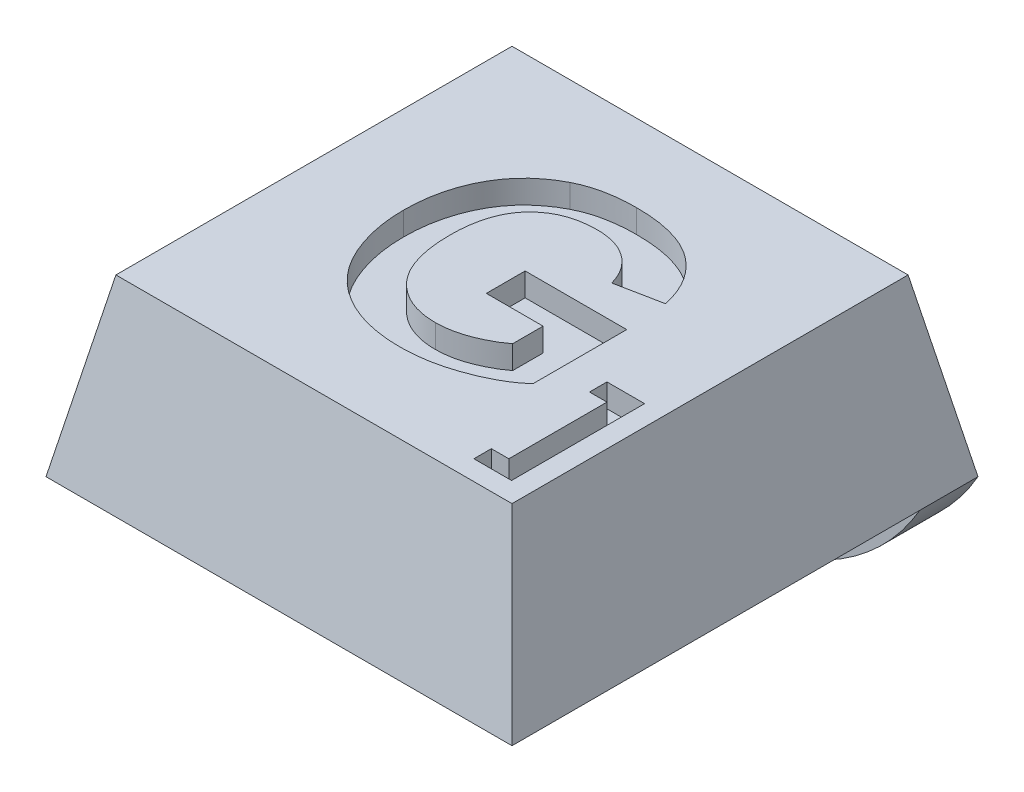
from build123d import *

# Parameters (mm, degrees)
SKETCH1_W               = 8
SKETCH1_H               = 8
BOSS_EXTRUDE1_DEPTH     = 3
CUT_EXTRUDE1_DEPTH      = 12.704699911
CUT_EXTRUDE1_DEPTH_BACK = 12.704699911
CUT_EXTRUDE2_DEPTH      = 11
SKETCH4_R               = 1.75
CUT_EXTRUDE3_DEPTH      = 0.4
SKETCH5_W               = 8
SKETCH5_H               = 1
BOSS_EXTRUDE2_DEPTH     = 2
FILLET1_R               = 4
CUT_EXTRUDE4_DEPTH      = 0.4
CUT_EXTRUDE5_DEPTH      = 0.4


with BuildPart() as part:
    # Sketch1 → Boss-Extrude1 (new body)
    with BuildSketch(Plane(origin=(0, 0, 0), x_dir=(1, 0, 0), z_dir=(0, 1, 0))):
        with Locations((4, 4)):
            Rectangle(SKETCH1_W, SKETCH1_H)
    extrude(amount=BOSS_EXTRUDE1_DEPTH)

    # Sketch2 → Cut-Extrude1 (cut, two sides: drawn at the far end of the back side and taken through both)
    with BuildSketch(Plane.XY.offset(-CUT_EXTRUDE1_DEPTH_BACK)):
        Polygon((0, 0), (0.6, 3), (0, 3), align=None)
        Polygon((8, 0), (7.4, 3), (8, 3), align=None)
    extrude(amount=CUT_EXTRUDE1_DEPTH + CUT_EXTRUDE1_DEPTH_BACK, mode=Mode.SUBTRACT)

    # Sketch3 → Cut-Extrude2 (cut)
    with BuildSketch(Plane(origin=(0, 0, 0), x_dir=(0, 0, -1), z_dir=(1, 0, 0))):
        Polygon((0, 0), (0.6, 3), (0, 3), align=None)
        Polygon((8, 3), (7.4, 3), (8, 0), align=None)
    extrude(amount=CUT_EXTRUDE2_DEPTH, mode=Mode.SUBTRACT)

    # Sketch4 → Cut-Extrude3 (cut)
    with BuildSketch(Plane.XZ):
        with Locations(Location((4, -3.75, 0), (0, 0, 270))):
            Circle(SKETCH4_R)
    extrude(amount=-CUT_EXTRUDE3_DEPTH, mode=Mode.SUBTRACT)

    # Sketch5 → Boss-Extrude2 (add)
    with BuildSketch(Plane.XZ):
        with Locations((4, -7.5)):
            Rectangle(SKETCH5_W, SKETCH5_H)
    extrude(amount=BOSS_EXTRUDE2_DEPTH)

    # Fillet1
    # the kernel refuses this fillet: 4 mm, written as the material it takes off along each edge
    with BuildSketch(Plane(origin=(8, -2, -16.660254038), x_dir=(0, 1, 0), z_dir=(0, 0, 1)), Plane(origin=(0, -2, 1.660254038), x_dir=(0, 1, 0), z_dir=(0, 0, -1))) as fillet1_piece_1:
        with BuildLine():
            CenterArc((4, 3.464101615), FILLET1_R, 180, 60)
            Line((0, 3.464101615), (-0.08, 3.464101615))
            Line((-0.08, 3.464101615), (-0.08, 0))
            Line((-0.08, 0), (0, -0.08))
            ThreePointArc((0, -0.08), (1, -0.08), (1.96, -0.069282032))
            Line((1.96, -0.069282032), (2, 0))
        make_face()
    extrude(amount=18.320508076, mode=Mode.SUBTRACT)

    # Sketch6 → Cut-Extrude4 (cut)
    with BuildSketch(Plane(origin=(0, 3, 0), x_dir=(1, 0, 0), z_dir=(0, 1, 0))):
        with BuildLine():
            Line((4.053794593, 3.505457585), (4.053794593, 4.172124252))
            Line((4.053794593, 4.172124252), (5.797384337, 4.172124252))
            Line((5.797384337, 4.172124252), (5.797384337, 2.564752457))
            add(Edge.make_bspline(
                [(5.797384337, 2.564752457), (5.775440275, 2.544992361), (5.730582172, 2.504598726), (5.657391115, 2.447633596), (5.576814656, 2.393249062), (5.489339896, 2.340343698), (5.394785806, 2.289343315), (5.293529517, 2.239537607), (5.185384208, 2.19141366), (5.032450931, 2.131128575), (4.835594452, 2.065533422), (4.594933471, 2.008496304), (4.352368706, 1.973513189), (4.190125473, 1.969167013), (4.109083055, 1.966996047)],
                knots=[0, 0, 0, 0, 0.581799769, 1.189316438, 1.825828404, 2.496525428, 3.203088405, 3.942228803, 4.719818701, 5.534979611, 7.181138583, 8.803804008, 10.403462225, 12, 12, 12, 12], degree=3))
            add(Edge.make_bspline(
                [(4.109083055, 1.966996047), (4.058312627, 1.967758979), (3.958229013, 1.969262944), (3.810482794, 1.981368296), (3.667847904, 2.002080495), (3.530208107, 2.031409962), (3.397097502, 2.066765974), (3.26907094, 2.111868039), (3.146582956, 2.166009466), (3.028523806, 2.226338905), (2.917094396, 2.295632176), (2.812187083, 2.371432832), (2.714561168, 2.454400196), (2.624566637, 2.544701507), (2.540998329, 2.641714843), (2.464831298, 2.745902822), (2.396526155, 2.857385727), (2.335239765, 2.974765127), (2.280716867, 3.097008702), (2.234709094, 3.223154334), (2.194374003, 3.351370526), (2.161222966, 3.482107416), (2.136875151, 3.615790052), (2.117947657, 3.751799892), (2.107781758, 3.890986734), (2.105984472, 3.984609884), (2.105076645, 4.031899893)],
                knots=[0, 0, 0, 0, 1.124918047, 2.217548049, 3.282233239, 4.316494221, 5.334437038, 6.332151046, 7.320712088, 8.300141923, 9.267552434, 10.225301062, 11.165776911, 12.103230934, 13.047553934, 14.000517593, 14.959782875, 15.941944936, 16.932894943, 17.923491392, 18.915624898, 19.910402922, 20.909870877, 21.92519501, 22.95199481, 24, 24, 24, 24], degree=3))
            add(Edge.make_bspline(
                [(2.105076645, 4.031899893), (2.105812881, 4.082940857), (2.107264322, 4.183564655), (2.119773705, 4.33228546), (2.139199297, 4.476648194), (2.168656936, 4.616390773), (2.20449512, 4.75216369), (2.248233589, 4.883877531), (2.301822866, 5.010556427), (2.361436063, 5.133283761), (2.429297714, 5.250362339), (2.505977563, 5.360290437), (2.589206445, 5.464176802), (2.680629029, 5.560371285), (2.779923369, 5.648827012), (2.886080088, 5.730522243), (2.998844963, 5.806865303), (3.079553832, 5.849911113), (3.120301004, 5.871643482)],
                knots=[0, 0, 0, 0, 1.105010302, 2.178452875, 3.229459892, 4.257086284, 5.268538906, 6.268935615, 7.259234261, 8.24469117, 9.221745683, 10.185929258, 11.144249683, 12.101504986, 13.055838221, 14.020611351, 15.000673771, 16, 16, 16, 16], degree=3))
            add(Edge.make_bspline(
                [(3.120301004, 5.871643482), (3.152638085, 5.887700047), (3.218317351, 5.920312247), (3.322813337, 5.959248923), (3.432101667, 5.994677516), (3.547832356, 6.021111591), (3.6692195, 6.042829226), (3.796209305, 6.059036287), (3.929210312, 6.067547239), (4.019595582, 6.068879104), (4.065813824, 6.069560149)],
                knots=[0, 0, 0, 0, 0.887969848, 1.803539625, 2.741143579, 3.713741423, 4.722068772, 5.775476617, 6.8624965, 8, 8, 8, 8], degree=3))
            add(Edge.make_bspline(
                [(4.065813824, 6.069560149), (4.125403824, 6.06867255), (4.241295356, 6.066946335), (4.410256532, 6.05256252), (4.569271079, 6.027772487), (4.718560435, 5.993629866), (4.857802985, 5.949731518), (4.986759025, 5.895763799), (5.106220057, 5.832812796), (5.214455834, 5.758355608), (5.313666102, 5.676257846), (5.403591975, 5.586419647), (5.48426965, 5.488707943), (5.555752499, 5.383614392), (5.617477906, 5.2707046), (5.670549966, 5.151008328), (5.714234697, 5.023616882), (5.73534656, 4.935145779), (5.746102286, 4.89007297)],
                knots=[0, 0, 0, 0, 1.271135529, 2.472123572, 3.614091059, 4.701890498, 5.736279567, 6.724681829, 7.680621489, 8.611506429, 9.52200816, 10.424540711, 11.318996785, 12.221421405, 13.131851814, 14.060431888, 15.011860567, 16, 16, 16, 16], degree=3))
            Line((5.746102286, 4.89007297), (4.976871517, 4.736226816))
            add(Edge.make_bspline(
                [(4.976871517, 4.736226816), (4.969254672, 4.761468809), (4.95422678, 4.81127079), (4.925094227, 4.882758251), (4.891539922, 4.949961192), (4.853483379, 5.013366036), (4.810541206, 5.072582433), (4.761675926, 5.126971617), (4.709961453, 5.179014495), (4.652020351, 5.225088646), (4.590259767, 5.266624284), (4.52537561, 5.304078684), (4.455901775, 5.334453158), (4.382811411, 5.358892727), (4.306461756, 5.37964837), (4.225856415, 5.392413169), (4.141900573, 5.402040295), (4.084540473, 5.402606041), (4.055397158, 5.402893482)],
                knots=[0, 0, 0, 0, 1.027736275, 2.027704492, 3.005900071, 3.954421694, 4.908588141, 5.853155543, 6.803277083, 7.766271258, 8.734041521, 9.704274878, 10.683578894, 11.68490234, 12.708089448, 13.76461009, 14.864251086, 16, 16, 16, 16], degree=3))
            add(Edge.make_bspline(
                [(4.055397158, 5.402893482), (4.01128773, 5.401716629), (3.925204424, 5.399419898), (3.799534269, 5.384433236), (3.680976007, 5.357770589), (3.569219615, 5.320994553), (3.46406021, 5.273789934), (3.366918824, 5.2143961), (3.275376693, 5.146327474), (3.192038786, 5.066438045), (3.116460773, 4.976859168), (3.051034483, 4.876522357), (2.996567377, 4.765751945), (2.951955713, 4.645104141), (2.91643531, 4.514573915), (2.892338718, 4.373699188), (2.876594443, 4.222696077), (2.875085403, 4.118480819), (2.874307414, 4.064752457)],
                knots=[0, 0, 0, 0, 1.043810997, 2.037086103, 2.989314757, 3.91471467, 4.817033861, 5.710208705, 6.603920097, 7.511448416, 8.435617211, 9.371747005, 10.338444094, 11.350425613, 12.411431869, 13.5347293, 14.729025275, 16, 16, 16, 16], degree=3))
            add(Edge.make_bspline(
                [(2.874307414, 4.064752457), (2.875118698, 4.00702506), (2.876695474, 3.894828493), (2.892027057, 3.732262921), (2.917247643, 3.580803592), (2.95342224, 3.44064155), (2.998941149, 3.311279521), (3.053656914, 3.192304252), (3.121182779, 3.085923464), (3.197244894, 2.990004781), (3.28225913, 2.906191636), (3.37384152, 2.833121051), (3.471482188, 2.77119638), (3.576081527, 2.721395085), (3.686320303, 2.681751972), (3.80321198, 2.653959398), (3.926408504, 2.636695674), (4.010734238, 2.634687946), (4.053794593, 2.633662713)],
                knots=[0, 0, 0, 0, 1.318042826, 2.561693173, 3.724929596, 4.821196409, 5.862977565, 6.853497791, 7.804600806, 8.73339865, 9.643480846, 10.524649628, 11.404635349, 12.277659519, 13.165160235, 14.075017549, 15.017020959, 16, 16, 16, 16], degree=3))
            add(Edge.make_bspline(
                [(4.053794593, 2.633662713), (4.097408334, 2.634875039), (4.185053042, 2.637311287), (4.316328539, 2.657956024), (4.448117665, 2.68833542), (4.577327471, 2.734163302), (4.70281192, 2.786727561), (4.819965055, 2.847306941), (4.929675356, 2.910453005), (4.995733738, 2.959668979), (5.028153568, 2.98382297)],
                knots=[0, 0, 0, 0, 0.993821502, 1.997150276, 3.023717651, 4.073291794, 5.118404464, 6.123376694, 7.078999408, 8, 8, 8, 8], degree=3))
            Line((5.028153568, 2.98382297), (5.028153568, 3.505457585))
            Line((5.028153568, 3.505457585), (4.053794593, 3.505457585))
        make_face()
    extrude(amount=-CUT_EXTRUDE4_DEPTH, mode=Mode.SUBTRACT)

    # Sketch7 → Cut-Extrude5 (cut)
    with BuildSketch(Plane(origin=(0, 3, 0), x_dir=(1, 0, 0), z_dir=(0, 1, 0))):
        Polygon((7.051946272, 3.224540865), (7.051946272, 0.93992548), (6.405792426, 0.93992548), (6.405792426, 1.23992548), (6.705792426, 1.23992548), (6.705792426, 2.924540865), (6.405792426, 2.924540865), (6.405792426, 3.224540865), align=None)
    extrude(amount=-CUT_EXTRUDE5_DEPTH, mode=Mode.SUBTRACT)


solid = part.part
